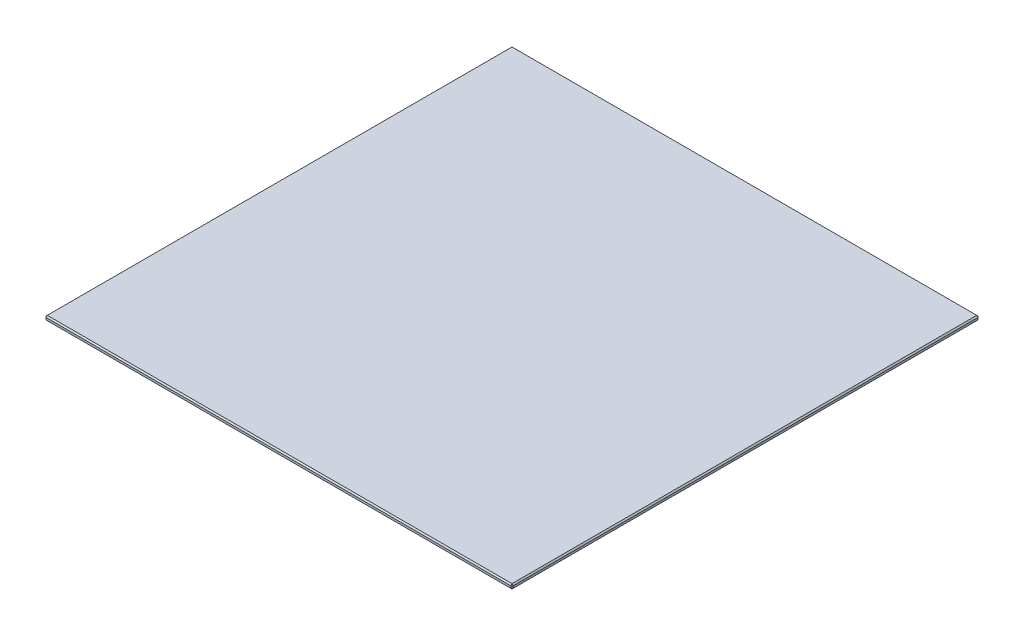
from build123d import *

# Parameters (mm, degrees)
SKETCH1_W           = 300
SKETCH1_H           = 300
BOSS_EXTRUDE1_DEPTH = 3
CHAMFER1_SIZE       = 0.8


with BuildPart() as part:
    # Sketch1 → Boss-Extrude1 (new body)
    with BuildSketch(Plane(origin=(0, 0, 0), x_dir=(1, 0, 0), z_dir=(0, 1, 0))):
        Rectangle(SKETCH1_W, SKETCH1_H)
    extrude(amount=BOSS_EXTRUDE1_DEPTH)

    # Chamfer1
    chamfer1_edges = [part.edges().sort_by_distance(p)[0] for p in [
        (150, 1.5, 150),
        (150, 0, 0),
        (150, 3, 0),
        (150, 1.5, -150),
        (0, 0, -150),
        (0, 3, -150),
        (-150, 1.5, -150),
        (-150, 0, 0),
        (0, 0, 150),
        (-150, 1.5, 150),
        (-150, 3, 0),
        (0, 3, 150),
    ]]
    chamfer(chamfer1_edges, length=CHAMFER1_SIZE)


solid = part.part
